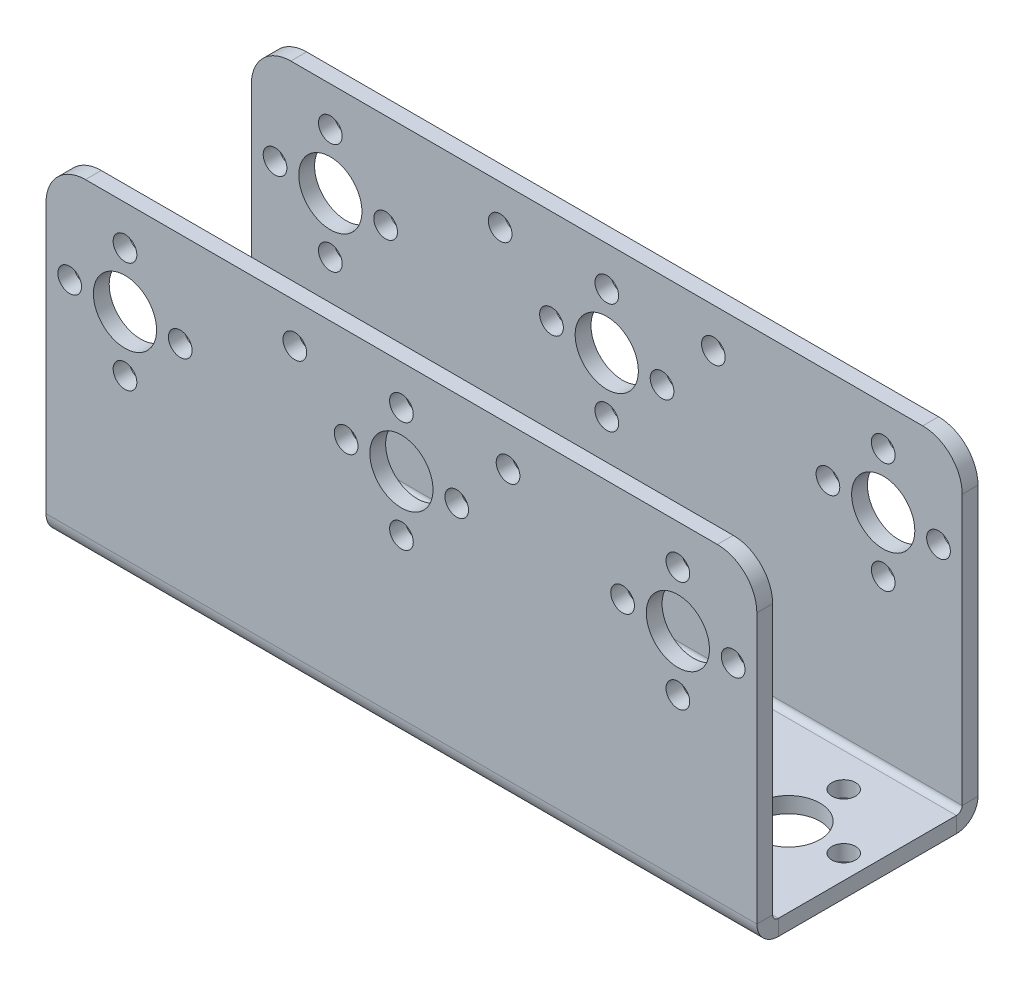
from build123d import *

# Parameters (mm, degrees)
SCHIZZO1_W                       = 90
SCHIZZO1_H                       = 28
BASE_FLANGIA1_DEPTH              = 2
BORDO_FLANGIA1_STRIP_W           = 9.4732
BORDO_FLANGIA1_STRIP_H           = 2
BORDO_FLANGIA1_STRIP_CUT_DEPTH   = 90
BORDO_FLANGIA1_STRIP_2_W         = 9.4732
BORDO_FLANGIA1_STRIP_2_H         = 2
BORDO_FLANGIA1_STRIP_CUT_2_DEPTH = 90
BORDO_FLANGIA1_DEPTH             = 90
BORDO_FLANGIA1_PROFILE_W         = 90
BORDO_FLANGIA1_PROFILE_H         = 39.1234
BORDO_FLANGIA1_PROFILE_R         = 1.5
BORDO_FLANGIA1_PROFILE_R_2       = 4
BORDO_FLANGIA1_FLAT_DEPTH        = 2
BORDO_FLANGIA1_BEND_DEPTH        = 90
BORDO_FLANGIA1_PROFILE_2_W       = 90
BORDO_FLANGIA1_PROFILE_2_H       = 39.1234
BORDO_FLANGIA1_PROFILE_2_R       = 1.5
BORDO_FLANGIA1_PROFILE_2_R_2     = 4
BORDO_FLANGIA1_FLAT_2_DEPTH      = 2
RACCORDO1_R                      = 5
CUT_EXTRUDE1_REACH               = 63.724
SCHIZZO4_R                       = 4
SCHIZZO4_R_2                     = 1.5


# Sheet-metal steps are written as plain solids
with BuildPart() as part:
    # Schizzo1 → Base-Flangia1 (new body)
    with BuildSketch(Plane(origin=(0, 0, 0), x_dir=(1, 0, 0), z_dir=(0, 1, 0))):
        Rectangle(SCHIZZO1_W, SCHIZZO1_H)
    extrude(amount=BASE_FLANGIA1_DEPTH)

    # Bordo-Flangia1 strip (across the edge) → Bordo-Flangia1 strip cut (cut)
    with BuildSketch(Plane(origin=(-45, 2, 14), x_dir=(0, 0, -1), z_dir=(1, 0, 0))):
        with Locations((-2, -1)):
            Rectangle(BORDO_FLANGIA1_STRIP_W, BORDO_FLANGIA1_STRIP_H)
    extrude(amount=BORDO_FLANGIA1_STRIP_CUT_DEPTH, mode=Mode.SUBTRACT)

    # Bordo-Flangia1 strip 2 (across the edge) → Bordo-Flangia1 strip cut 2 (cut)
    with BuildSketch(Plane(origin=(45, 2, -14), x_dir=(0, 0, 1), z_dir=(-1, 0, 0))):
        with Locations((-2, -1)):
            Rectangle(BORDO_FLANGIA1_STRIP_2_W, BORDO_FLANGIA1_STRIP_2_H)
    extrude(amount=BORDO_FLANGIA1_STRIP_CUT_2_DEPTH, mode=Mode.SUBTRACT)

    # Bordo-Flangia1 bend section (across the edge) → Bordo-Flangia1 (add)
    with BuildSketch(Plane(origin=(-45, 2, 14), x_dir=(0, 0, -1), z_dir=(1, 0, 0))):
        with BuildLine():
            Line((0, 0.7366), (2, 0.7366))
            ThreePointArc((2, 0.7366), (2.215745145, 0.215745145), (2.7366, 0))
            Line((2.7366, 0), (2.7366, -2))
            ThreePointArc((2.7366, -2), (0.801531583, -1.198468417), (0, 0.7366))
        make_face()
    extrude(amount=BORDO_FLANGIA1_DEPTH)

    # Bordo-Flangia1 profile (on flange) → Bordo-Flangia1 flat (add)
    with BuildSketch(Plane(origin=(0, 2, 14), x_dir=(-1, 0, 0), z_dir=(0, 0, -1))):
        with Locations((0, 20.2983)):
            Rectangle(BORDO_FLANGIA1_PROFILE_W, BORDO_FLANGIA1_PROFILE_H)
        with Locations((35, 20.86)):
            Circle(BORDO_FLANGIA1_PROFILE_R, mode=Mode.SUBTRACT)
        with Locations((0, 20.86)):
            Circle(BORDO_FLANGIA1_PROFILE_R, mode=Mode.SUBTRACT)
        with Locations((-35, 20.86)):
            Circle(BORDO_FLANGIA1_PROFILE_R, mode=Mode.SUBTRACT)
        with Locations((42, 27.86)):
            Circle(BORDO_FLANGIA1_PROFILE_R, mode=Mode.SUBTRACT)
        with Locations((35, 27.86)):
            Circle(BORDO_FLANGIA1_PROFILE_R_2, mode=Mode.SUBTRACT)
        with Locations((28, 27.86)):
            Circle(BORDO_FLANGIA1_PROFILE_R, mode=Mode.SUBTRACT)
        with Locations((7, 27.86)):
            Circle(BORDO_FLANGIA1_PROFILE_R, mode=Mode.SUBTRACT)
        with Locations((35, 34.86)):
            Circle(BORDO_FLANGIA1_PROFILE_R, mode=Mode.SUBTRACT)
        with Locations((13.5, 34.86)):
            Circle(BORDO_FLANGIA1_PROFILE_R, mode=Mode.SUBTRACT)
        with Locations((0, 27.86)):
            Circle(BORDO_FLANGIA1_PROFILE_R_2, mode=Mode.SUBTRACT)
        with Locations((-7, 27.86)):
            Circle(BORDO_FLANGIA1_PROFILE_R, mode=Mode.SUBTRACT)
        with Locations((-28, 27.86)):
            Circle(BORDO_FLANGIA1_PROFILE_R, mode=Mode.SUBTRACT)
        with Locations((-35, 27.86)):
            Circle(BORDO_FLANGIA1_PROFILE_R_2, mode=Mode.SUBTRACT)
        with Locations((-42, 27.86)):
            Circle(BORDO_FLANGIA1_PROFILE_R, mode=Mode.SUBTRACT)
        with Locations((0, 34.86)):
            Circle(BORDO_FLANGIA1_PROFILE_R, mode=Mode.SUBTRACT)
        with Locations((-13.5, 34.86)):
            Circle(BORDO_FLANGIA1_PROFILE_R, mode=Mode.SUBTRACT)
        with Locations((-35, 34.86)):
            Circle(BORDO_FLANGIA1_PROFILE_R, mode=Mode.SUBTRACT)
    extrude(amount=BORDO_FLANGIA1_FLAT_DEPTH)

    # Bordo-Flangia1 bend section 2 (across the edge) → Bordo-Flangia1 bend (add)
    with BuildSketch(Plane(origin=(45, 2, -14), x_dir=(0, 0, 1), z_dir=(-1, 0, 0))):
        with BuildLine():
            Line((0, 0.7366), (2, 0.7366))
            ThreePointArc((2, 0.7366), (2.215745145, 0.215745145), (2.7366, 0))
            Line((2.7366, 0), (2.7366, -2))
            ThreePointArc((2.7366, -2), (0.801531583, -1.198468417), (0, 0.7366))
        make_face()
    extrude(amount=BORDO_FLANGIA1_BEND_DEPTH)

    # Bordo-Flangia1 profile 2 (on flange) → Bordo-Flangia1 flat 2 (add)
    with BuildSketch(Plane(origin=(0, 2, -14), x_dir=(1, 0, 0), z_dir=(0, 0, 1))):
        with Locations((0, 20.2983)):
            Rectangle(BORDO_FLANGIA1_PROFILE_2_W, BORDO_FLANGIA1_PROFILE_2_H)
        with Locations((35, 20.86)):
            Circle(BORDO_FLANGIA1_PROFILE_2_R, mode=Mode.SUBTRACT)
        with Locations((0, 20.86)):
            Circle(BORDO_FLANGIA1_PROFILE_2_R, mode=Mode.SUBTRACT)
        with Locations((-35, 20.86)):
            Circle(BORDO_FLANGIA1_PROFILE_2_R, mode=Mode.SUBTRACT)
        with Locations((42, 27.86)):
            Circle(BORDO_FLANGIA1_PROFILE_2_R, mode=Mode.SUBTRACT)
        with Locations((35, 27.86)):
            Circle(BORDO_FLANGIA1_PROFILE_2_R_2, mode=Mode.SUBTRACT)
        with Locations((28, 27.86)):
            Circle(BORDO_FLANGIA1_PROFILE_2_R, mode=Mode.SUBTRACT)
        with Locations((7, 27.86)):
            Circle(BORDO_FLANGIA1_PROFILE_2_R, mode=Mode.SUBTRACT)
        with Locations((35, 34.86)):
            Circle(BORDO_FLANGIA1_PROFILE_2_R, mode=Mode.SUBTRACT)
        with Locations((13.5, 34.86)):
            Circle(BORDO_FLANGIA1_PROFILE_2_R, mode=Mode.SUBTRACT)
        with Locations((0, 27.86)):
            Circle(BORDO_FLANGIA1_PROFILE_2_R_2, mode=Mode.SUBTRACT)
        with Locations((-7, 27.86)):
            Circle(BORDO_FLANGIA1_PROFILE_2_R, mode=Mode.SUBTRACT)
        with Locations((-28, 27.86)):
            Circle(BORDO_FLANGIA1_PROFILE_2_R, mode=Mode.SUBTRACT)
        with Locations((-35, 27.86)):
            Circle(BORDO_FLANGIA1_PROFILE_2_R_2, mode=Mode.SUBTRACT)
        with Locations((-42, 27.86)):
            Circle(BORDO_FLANGIA1_PROFILE_2_R, mode=Mode.SUBTRACT)
        with Locations((0, 34.86)):
            Circle(BORDO_FLANGIA1_PROFILE_2_R, mode=Mode.SUBTRACT)
        with Locations((-13.5, 34.86)):
            Circle(BORDO_FLANGIA1_PROFILE_2_R, mode=Mode.SUBTRACT)
        with Locations((-35, 34.86)):
            Circle(BORDO_FLANGIA1_PROFILE_2_R, mode=Mode.SUBTRACT)
    extrude(amount=BORDO_FLANGIA1_FLAT_2_DEPTH)

    # Raccordo1
    raccordo1_edges = [part.edges().sort_by_distance(p)[0] for p in [
        (-45, 41.86, -13),
        (-45, 41.86, 13),
        (45, 41.86, 13),
        (45, 41.86, -13),
    ]]
    fillet(raccordo1_edges, radius=RACCORDO1_R)

    # Schizzo4 → Cut-Extrude1 (cut, up to next)
    with BuildSketch(Plane(origin=(0, 2, 0), x_dir=(1, 0, 0), z_dir=(0, 1, 0)), mode=Mode.PRIVATE) as cut_extrude1_sk1:
        with Locations(Location((-35, 0, 0), (0, 0, 270))):
            Circle(SCHIZZO4_R)
    cut_extrude1_tool1 = extrude(cut_extrude1_sk1.sketch, amount=-CUT_EXTRUDE1_REACH, mode=Mode.PRIVATE) & part.part
    # Schizzo4 → Cut-Extrude1 (cut, up to next)
    with BuildSketch(Plane(origin=(0, 2, 0), x_dir=(1, 0, 0), z_dir=(0, 1, 0)), mode=Mode.PRIVATE) as cut_extrude1_sk2:
        with Locations(Location((0, 0, 0), (0, 0, 270))):
            Circle(SCHIZZO4_R)
    cut_extrude1_tool2 = extrude(cut_extrude1_sk2.sketch, amount=-CUT_EXTRUDE1_REACH, mode=Mode.PRIVATE) & part.part
    # Schizzo4 → Cut-Extrude1 (cut, up to next)
    with BuildSketch(Plane(origin=(0, 2, 0), x_dir=(1, 0, 0), z_dir=(0, 1, 0)), mode=Mode.PRIVATE) as cut_extrude1_sk3:
        with Locations(Location((35, 0, 0), (0, 0, 270))):
            Circle(SCHIZZO4_R)
    cut_extrude1_tool3 = extrude(cut_extrude1_sk3.sketch, amount=-CUT_EXTRUDE1_REACH, mode=Mode.PRIVATE) & part.part
    # Schizzo4 → Cut-Extrude1 (cut, up to next)
    with BuildSketch(Plane(origin=(0, 2, 0), x_dir=(1, 0, 0), z_dir=(0, 1, 0)), mode=Mode.PRIVATE) as cut_extrude1_sk4:
        with Locations(Location((-35, 7, 0), (0, 0, 270))):
            Circle(SCHIZZO4_R_2)
    cut_extrude1_tool4 = extrude(cut_extrude1_sk4.sketch, amount=-CUT_EXTRUDE1_REACH, mode=Mode.PRIVATE) & part.part
    # Schizzo4 → Cut-Extrude1 (cut, up to next)
    with BuildSketch(Plane(origin=(0, 2, 0), x_dir=(1, 0, 0), z_dir=(0, 1, 0)), mode=Mode.PRIVATE) as cut_extrude1_sk5:
        with Locations(Location((-28, 0, 0), (0, 0, 270))):
            Circle(SCHIZZO4_R_2)
    cut_extrude1_tool5 = extrude(cut_extrude1_sk5.sketch, amount=-CUT_EXTRUDE1_REACH, mode=Mode.PRIVATE) & part.part
    # Schizzo4 → Cut-Extrude1 (cut, up to next)
    with BuildSketch(Plane(origin=(0, 2, 0), x_dir=(1, 0, 0), z_dir=(0, 1, 0)), mode=Mode.PRIVATE) as cut_extrude1_sk6:
        with Locations(Location((-35, -7, 0), (0, 0, 270))):
            Circle(SCHIZZO4_R_2)
    cut_extrude1_tool6 = extrude(cut_extrude1_sk6.sketch, amount=-CUT_EXTRUDE1_REACH, mode=Mode.PRIVATE) & part.part
    # Schizzo4 → Cut-Extrude1 (cut, up to next)
    with BuildSketch(Plane(origin=(0, 2, 0), x_dir=(1, 0, 0), z_dir=(0, 1, 0)), mode=Mode.PRIVATE) as cut_extrude1_sk7:
        with Locations(Location((-42, 0, 0), (0, 0, 270))):
            Circle(SCHIZZO4_R_2)
    cut_extrude1_tool7 = extrude(cut_extrude1_sk7.sketch, amount=-CUT_EXTRUDE1_REACH, mode=Mode.PRIVATE) & part.part
    # Schizzo4 → Cut-Extrude1 (cut, up to next)
    with BuildSketch(Plane(origin=(0, 2, 0), x_dir=(1, 0, 0), z_dir=(0, 1, 0)), mode=Mode.PRIVATE) as cut_extrude1_sk8:
        with Locations(Location((-7, 0, 0), (0, 0, 270))):
            Circle(SCHIZZO4_R_2)
    cut_extrude1_tool8 = extrude(cut_extrude1_sk8.sketch, amount=-CUT_EXTRUDE1_REACH, mode=Mode.PRIVATE) & part.part
    # Schizzo4 → Cut-Extrude1 (cut, up to next)
    with BuildSketch(Plane(origin=(0, 2, 0), x_dir=(1, 0, 0), z_dir=(0, 1, 0)), mode=Mode.PRIVATE) as cut_extrude1_sk9:
        with Locations(Location((0, 7, 0), (0, 0, 270))):
            Circle(SCHIZZO4_R_2)
    cut_extrude1_tool9 = extrude(cut_extrude1_sk9.sketch, amount=-CUT_EXTRUDE1_REACH, mode=Mode.PRIVATE) & part.part
    # Schizzo4 → Cut-Extrude1 (cut, up to next)
    with BuildSketch(Plane(origin=(0, 2, 0), x_dir=(1, 0, 0), z_dir=(0, 1, 0)), mode=Mode.PRIVATE) as cut_extrude1_sk10:
        with Locations(Location((7, 0, 0), (0, 0, 270))):
            Circle(SCHIZZO4_R_2)
    cut_extrude1_tool10 = extrude(cut_extrude1_sk10.sketch, amount=-CUT_EXTRUDE1_REACH, mode=Mode.PRIVATE) & part.part
    # Schizzo4 → Cut-Extrude1 (cut, up to next)
    with BuildSketch(Plane(origin=(0, 2, 0), x_dir=(1, 0, 0), z_dir=(0, 1, 0)), mode=Mode.PRIVATE) as cut_extrude1_sk11:
        with Locations(Location((0, -7, 0), (0, 0, 270))):
            Circle(SCHIZZO4_R_2)
    cut_extrude1_tool11 = extrude(cut_extrude1_sk11.sketch, amount=-CUT_EXTRUDE1_REACH, mode=Mode.PRIVATE) & part.part
    # Schizzo4 → Cut-Extrude1 (cut, up to next)
    with BuildSketch(Plane(origin=(0, 2, 0), x_dir=(1, 0, 0), z_dir=(0, 1, 0)), mode=Mode.PRIVATE) as cut_extrude1_sk12:
        with Locations(Location((35, -7, 0), (0, 0, 270))):
            Circle(SCHIZZO4_R_2)
    cut_extrude1_tool12 = extrude(cut_extrude1_sk12.sketch, amount=-CUT_EXTRUDE1_REACH, mode=Mode.PRIVATE) & part.part
    # Schizzo4 → Cut-Extrude1 (cut, up to next)
    with BuildSketch(Plane(origin=(0, 2, 0), x_dir=(1, 0, 0), z_dir=(0, 1, 0)), mode=Mode.PRIVATE) as cut_extrude1_sk13:
        with Locations(Location((28, 0, 0), (0, 0, 270))):
            Circle(SCHIZZO4_R_2)
    cut_extrude1_tool13 = extrude(cut_extrude1_sk13.sketch, amount=-CUT_EXTRUDE1_REACH, mode=Mode.PRIVATE) & part.part
    # Schizzo4 → Cut-Extrude1 (cut, up to next)
    with BuildSketch(Plane(origin=(0, 2, 0), x_dir=(1, 0, 0), z_dir=(0, 1, 0)), mode=Mode.PRIVATE) as cut_extrude1_sk14:
        with Locations(Location((35, 7, 0), (0, 0, 270))):
            Circle(SCHIZZO4_R_2)
    cut_extrude1_tool14 = extrude(cut_extrude1_sk14.sketch, amount=-CUT_EXTRUDE1_REACH, mode=Mode.PRIVATE) & part.part
    # Schizzo4 → Cut-Extrude1 (cut, up to next)
    with BuildSketch(Plane(origin=(0, 2, 0), x_dir=(1, 0, 0), z_dir=(0, 1, 0)), mode=Mode.PRIVATE) as cut_extrude1_sk15:
        with Locations(Location((42, 0, 0), (0, 0, 270))):
            Circle(SCHIZZO4_R_2)
    cut_extrude1_tool15 = extrude(cut_extrude1_sk15.sketch, amount=-CUT_EXTRUDE1_REACH, mode=Mode.PRIVATE) & part.part
    add(cut_extrude1_tool1.solids().sort_by_distance((-35, 2, 0))[0], mode=Mode.SUBTRACT)
    add(cut_extrude1_tool2.solids().sort_by_distance((0, 2, 0))[0], mode=Mode.SUBTRACT)
    add(cut_extrude1_tool3.solids().sort_by_distance((35, 2, 0))[0], mode=Mode.SUBTRACT)
    add(cut_extrude1_tool4.solids().sort_by_distance((-35, 2, -7))[0], mode=Mode.SUBTRACT)
    add(cut_extrude1_tool5.solids().sort_by_distance((-28, 2, 0))[0], mode=Mode.SUBTRACT)
    add(cut_extrude1_tool6.solids().sort_by_distance((-35, 2, 7))[0], mode=Mode.SUBTRACT)
    add(cut_extrude1_tool7.solids().sort_by_distance((-42, 2, 0))[0], mode=Mode.SUBTRACT)
    add(cut_extrude1_tool8.solids().sort_by_distance((-7, 2, 0))[0], mode=Mode.SUBTRACT)
    add(cut_extrude1_tool9.solids().sort_by_distance((0, 2, -7))[0], mode=Mode.SUBTRACT)
    add(cut_extrude1_tool10.solids().sort_by_distance((7, 2, 0))[0], mode=Mode.SUBTRACT)
    add(cut_extrude1_tool11.solids().sort_by_distance((0, 2, 7))[0], mode=Mode.SUBTRACT)
    add(cut_extrude1_tool12.solids().sort_by_distance((35, 2, 7))[0], mode=Mode.SUBTRACT)
    add(cut_extrude1_tool13.solids().sort_by_distance((28, 2, 0))[0], mode=Mode.SUBTRACT)
    add(cut_extrude1_tool14.solids().sort_by_distance((35, 2, -7))[0], mode=Mode.SUBTRACT)
    add(cut_extrude1_tool15.solids().sort_by_distance((42, 2, 0))[0], mode=Mode.SUBTRACT)


solid = part.part
